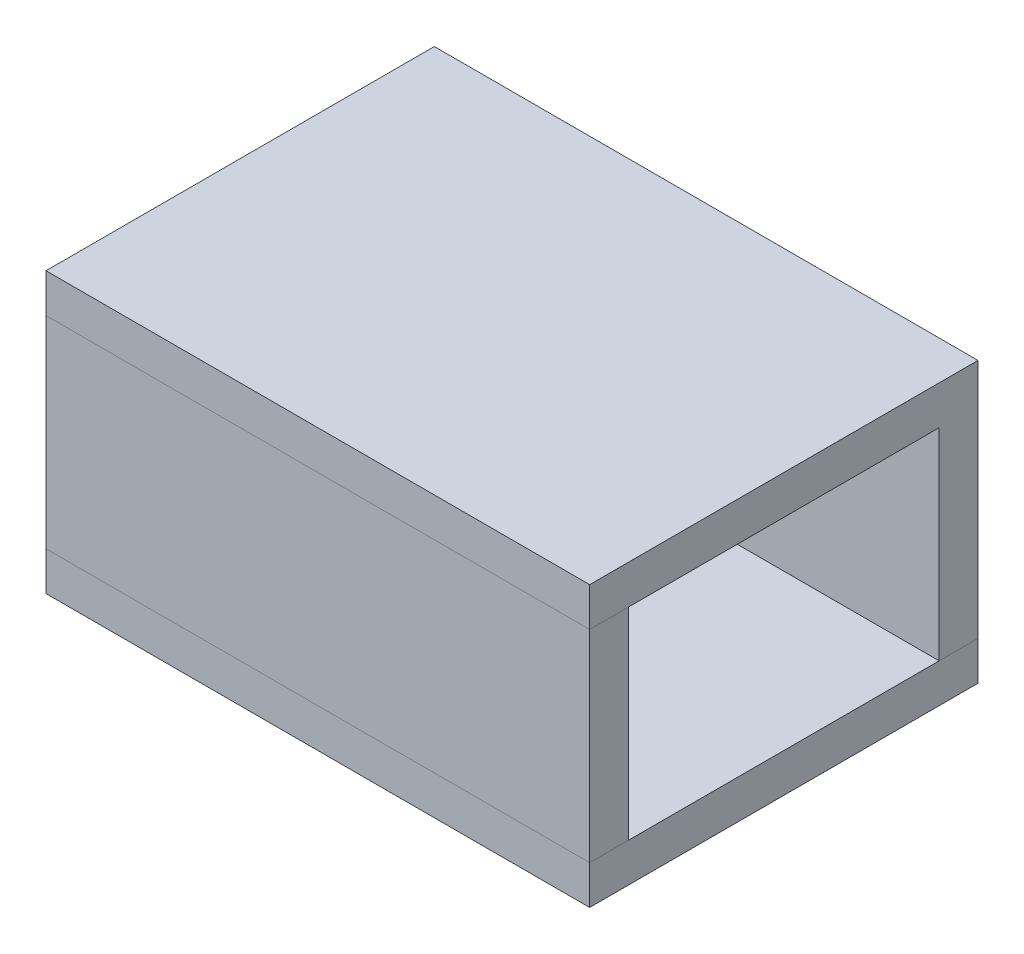
from build123d import *

# Parameters (mm, degrees)
SKETCH1_W           = 25
SKETCH1_H           = 18
BOSS_EXTRUDE1_DEPTH = 35
SHELL1_T            = -2.5
SPLIT1_START        = -9
SPLIT1_OUTLINE_W    = 35
SPLIT1_OUTLINE_H    = 25
SPLIT1_DEPTH        = 2.5
SPLIT1_START_2      = -6.5
SPLIT1_2_OUTLINE_W  = 35
SPLIT1_2_OUTLINE_H  = 2.5
SPLIT1_2_DEPTH      = 13
SPLIT1_3_OUTLINE_W  = 35
SPLIT1_3_OUTLINE_H  = 2.5
SPLIT1_3_DEPTH      = 13
SPLIT1_4_OUTLINE_W  = 35
SPLIT1_4_OUTLINE_H  = 25
SPLIT1_4_DEPTH      = 2.5


# Read off the part's stored shape, not the designer's step: Split1
with BuildPart() as part:
    # Sketch1 → Boss-Extrude1 (new body)
    with BuildSketch(Plane(origin=(0, 0, 0), x_dir=(0, 0, -1), z_dir=(1, 0, 0))):
        Rectangle(SKETCH1_W, SKETCH1_H)
    extrude(amount=BOSS_EXTRUDE1_DEPTH)

    # Shell1
    shell1_openings = [part.faces().sort_by_distance(p)[0] for p in [
        (35, 0, 0),
        (0, 0, 0),
    ]]
    offset(amount=SHELL1_T, openings=shell1_openings, kind=Kind.INTERSECTION)

    # Split1 outline → Split1 (cut)
    with BuildSketch(Plane(origin=(0, 0, 0), x_dir=(1, 0, 0), z_dir=(0, 1, 0)).offset(SPLIT1_START)):
        with Locations((17.5, 0)):
            Rectangle(SPLIT1_OUTLINE_W, SPLIT1_OUTLINE_H)
    extrude(amount=SPLIT1_DEPTH, mode=Mode.SUBTRACT)

    # Split1 2 outline → Split1 2 (cut)
    with BuildSketch(Plane(origin=(0, 0, 0), x_dir=(1, 0, 0), z_dir=(0, 1, 0)).offset(SPLIT1_START_2)):
        with Locations((17.5, -11.25)):
            Rectangle(SPLIT1_2_OUTLINE_W, SPLIT1_2_OUTLINE_H)
    extrude(amount=SPLIT1_2_DEPTH, mode=Mode.SUBTRACT)


with BuildPart() as body_2:
    # Split1 3 outline → Split1 3 (new body)
    with BuildSketch(Plane(origin=(0, 0, 0), x_dir=(1, 0, 0), z_dir=(0, 1, 0)).offset(SPLIT1_START_2)):
        with Locations((17.5, -11.25)):
            Rectangle(SPLIT1_3_OUTLINE_W, SPLIT1_3_OUTLINE_H)
    extrude(amount=SPLIT1_3_DEPTH)


with BuildPart() as body_3:
    # Split1 4 outline → Split1 4 (new body)
    with BuildSketch(Plane(origin=(0, 0, 0), x_dir=(1, 0, 0), z_dir=(0, 1, 0)).offset(SPLIT1_START)):
        with Locations((17.5, 0)):
            Rectangle(SPLIT1_4_OUTLINE_W, SPLIT1_4_OUTLINE_H)
    extrude(amount=SPLIT1_4_DEPTH)


solid = Compound([part.part, body_2.part, body_3.part])
